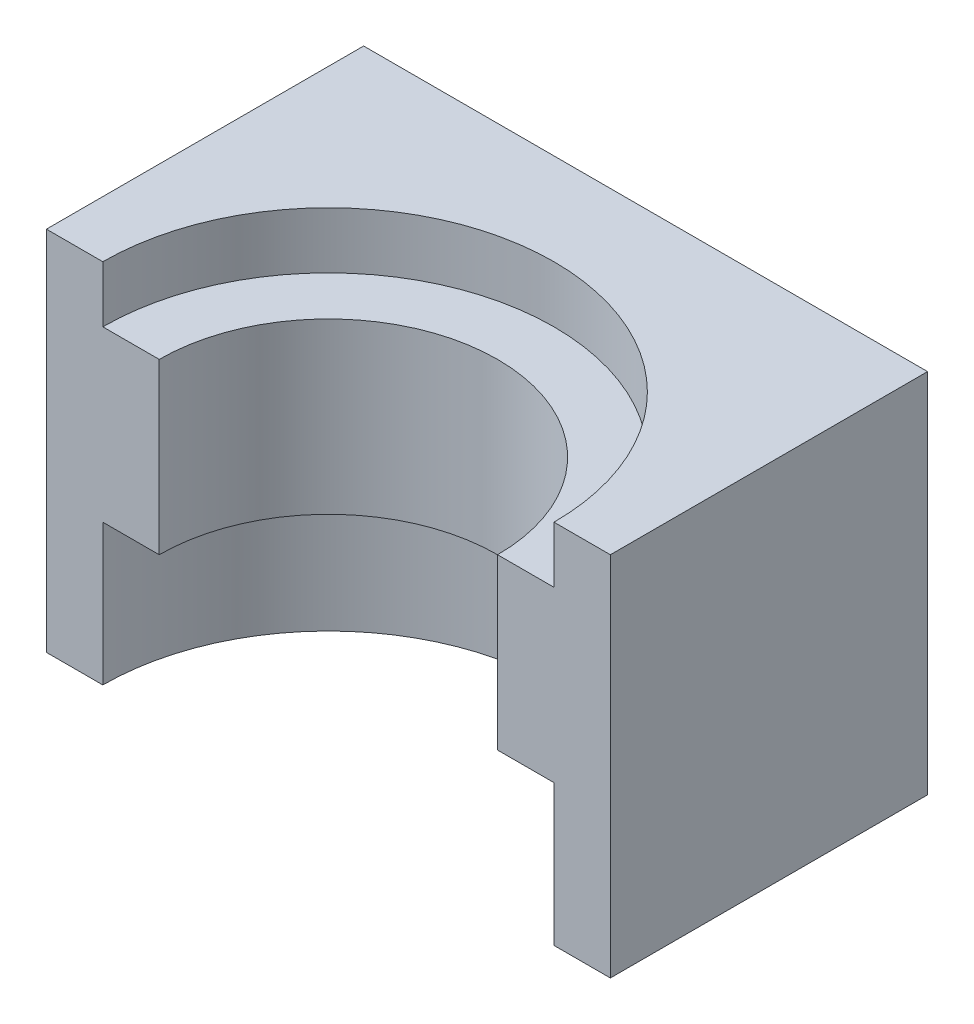
from build123d import *

# Parameters (mm, degrees)
EXTRUDE_1_DEPTH     = 5
EXTRUDE_2_DEPTH     = 6
EXTRUDE_3_DEPTH     = 2
SKETCH_4_R          = 13.5
CUT_EXTRUDE_1_DEPTH = 4


with BuildPart() as part:
    # 草图1 → 凸台-拉伸1 (new body)
    with BuildSketch(Plane(origin=(0, 0, 0), x_dir=(1, 0, 0), z_dir=(0, 1, 0))):
        with BuildLine():
            Line((0, 8.75), (2, 8.75))
            ThreePointArc((2, 8.75), (10, 16.75), (18, 8.75))
            Line((18, 8.75), (20, 8.75))
            Line((20, 8.75), (20, 20))
            Line((20, 20), (0, 20))
            Line((0, 20), (0, 8.75))
        make_face()
    extrude(amount=EXTRUDE_1_DEPTH)

    # 草图2 → 凸台-拉伸2 (add)
    with BuildSketch(Plane(origin=(0, 5, 0), x_dir=(1, 0, 0), z_dir=(0, 1, 0))):
        with BuildLine():
            Line((16, 8.75), (20, 8.75))
            Line((20, 8.75), (20, 20))
            Line((20, 20), (0, 20))
            Line((0, 20), (0, 8.75))
            Line((0, 8.75), (4, 8.75))
            ThreePointArc((4, 8.75), (10, 14.75), (16, 8.75))
        make_face()
    extrude(amount=EXTRUDE_2_DEPTH)

    # 草图3 → 凸台-拉伸3 (add)
    with BuildSketch(Plane(origin=(0, 11, 0), x_dir=(1, 0, 0), z_dir=(0, 1, 0))):
        with BuildLine():
            Line((18, 8.75), (20, 8.75))
            Line((20, 8.75), (20, 20))
            Line((20, 20), (0, 20))
            Line((0, 20), (0, 8.75))
            Line((0, 8.75), (2, 8.75))
            ThreePointArc((2, 8.75), (10, 16.75), (18, 8.75))
        make_face()
    extrude(amount=EXTRUDE_3_DEPTH)

    # 草图4 → 切除-拉伸1 (cut)
    with BuildSketch(Plane(origin=(0, 0, -20), x_dir=(-1, 0, 0), z_dir=(0, 0, -1))):
        with Locations((-13.5, -13)):
            Circle(SKETCH_4_R)
    extrude(amount=-CUT_EXTRUDE_1_DEPTH, mode=Mode.SUBTRACT)


solid = part.part
